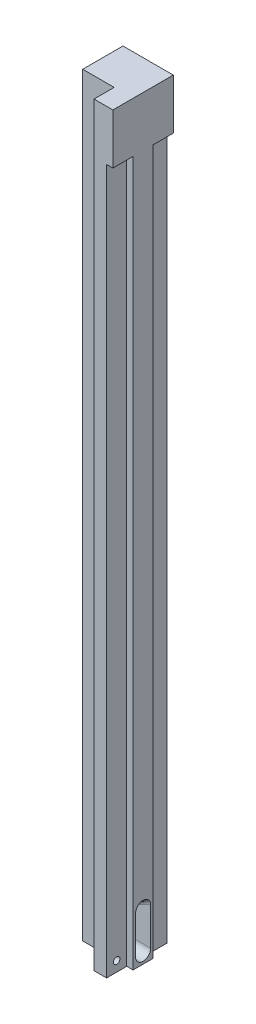
from build123d import *

# Parameters (mm, degrees)
SKETCH1_W           = 12.7
SKETCH1_H           = 190.5
BOSS_EXTRUDE1_DEPTH = 5.08
SKETCH5_W           = 3.175
SKETCH5_H           = 5.08
SKETCH5_W_2         = 11.1125
BOSS_EXTRUDE2_DEPTH = 190.5
SKETCH6_R           = 0.8255
CUT_EXTRUDE1_DEPTH  = 97.432752618
SKETCH7_W           = 1.5875
SKETCH7_H           = 5.08
BOSS_EXTRUDE3_DEPTH = 12.7


with BuildPart() as part:
    # Sketch1 → Boss-Extrude1 (new body)
    with BuildSketch(Plane.XY):
        Rectangle(SKETCH1_W, SKETCH1_H)
    extrude(amount=BOSS_EXTRUDE1_DEPTH)

    # Cut-Loft1: read off the stored shape, not the designer's step
    # Cut-Loft1: loft between two sections, ruled curve by curve
    cut_loft1_from = [
        Edge.make_bspline([(6.35, -92.71, 0.635), (6.35, -92.880627047, 0.635), (6.35, -93.190295538, 0.679451635), (6.35, -93.580426831, 0.829875615), (6.35, -93.904017113, 1.040042177), (6.35, -94.252532736, 1.378638842), (6.35, -94.539016945, 1.880682246), (6.35, -94.652993182, 2.54), (6.35, -94.539016945, 3.199317754), (6.35, -94.252532736, 3.701361158), (6.35, -93.904017113, 4.039957823), (6.35, -93.580426831, 4.250124385), (6.35, -93.190295538, 4.400548365), (6.35, -92.880627047, 4.445), (6.35, -92.100030361, 4.445), (6.35, -90.729103522, 4.445), (6.35, -87.9475, 4.445), (6.35, -85.165896478, 4.445), (6.35, -83.794969639, 4.445), (6.35, -83.185, 4.445)], [0, 0, 0, 0, 0.033003864, 0.066007727, 0.099011591, 0.132015455, 0.198023182, 0.264030909, 0.330038636, 0.396046364, 0.429050227, 0.462054091, 0.495057954, 0.528061818, 0.528061818, 0.646046364, 0.764030909, 0.882015455, 1, 1, 1, 1], 3),
        Edge.make_bspline([(6.35, -83.185, 4.445), (6.35, -82.922150477, 4.445), (6.35, -82.421175953, 4.339900308), (6.35, -81.805369524, 3.916723034), (6.35, -81.386700238, 3.309409446), (6.35, -81.226649881, 2.54), (6.35, -81.386700238, 1.770590554), (6.35, -81.805369524, 1.163276966), (6.35, -82.421175953, 0.740099692), (6.35, -82.922150477, 0.635), (6.35, -83.185, 0.635)], [0, 0, 0, 0, 0.125, 0.25, 0.375, 0.5, 0.625, 0.75, 0.875, 1, 1, 1, 1], 3),
        Edge.make_line((6.35, -92.71, 0.635), (6.35, -83.185, 0.635)),
    ]
    cut_loft1_to = [
        Edge.make_bspline([(-6.35, -92.71, 0.635), (-6.35, -92.81076887, 0.635), (-6.35, -93.018481978, 0.65100327), (-6.35, -93.339219021, 0.731183475), (-6.35, -93.659764721, 0.875704473), (-6.35, -94.064204291, 1.159019535), (-6.35, -94.484151999, 1.692137872), (-6.35, -94.680912476, 2.54), (-6.35, -94.484151999, 3.387862128), (-6.35, -94.064204291, 3.920980465), (-6.35, -93.659764721, 4.204295527), (-6.35, -93.339219021, 4.348816525), (-6.35, -93.018481978, 4.42899673), (-6.35, -92.81076887, 4.445), (-6.35, -92.349764316, 4.445), (-6.35, -91.828550912, 4.445), (-6.35, -91.1225, 4.445), (-6.35, -90.416449088, 4.445), (-6.35, -89.895235684, 4.445), (-6.35, -89.535, 4.445)], [0, 0, 0, 0, 0.033003864, 0.066007727, 0.099011591, 0.132015455, 0.198023182, 0.264030909, 0.330038636, 0.396046364, 0.429050227, 0.462054091, 0.495057954, 0.528061818, 0.528061818, 0.646046364, 0.764030909, 0.882015455, 1, 1, 1, 1], 3),
        Edge.make_bspline([(-6.35, -89.535, 4.445), (-6.35, -89.535, 4.28625), (-6.35, -89.535, 3.96875), (-6.35, -89.535, 3.4925), (-6.35, -89.535, 3.01625), (-6.35, -89.535, 2.54), (-6.35, -89.535, 2.06375), (-6.35, -89.535, 1.5875), (-6.35, -89.535, 1.11125), (-6.35, -89.535, 0.79375), (-6.35, -89.535, 0.635)], [0, 0, 0, 0, 0.125, 0.25, 0.375, 0.5, 0.625, 0.75, 0.875, 1, 1, 1, 1], 3),
        Edge.make_line((-6.35, -92.71, 0.635), (-6.35, -89.535, 0.635)),
    ]
    cut_loft1 = Solid(Shell([*[Face.make_surface_from_curves(cut_loft1_from[k], cut_loft1_to[k]) for k in range(3)], Face(Wire(cut_loft1_from)), Face(Wire(cut_loft1_to))]))
    add(cut_loft1, mode=Mode.SUBTRACT)

    # Sketch5 → Boss-Extrude2 (add)
    with BuildSketch(Plane.XZ.offset(95.25)):
        with Locations((3.175, 7.62)):
            Rectangle(SKETCH5_W, SKETCH5_H)
        with Locations((-0.79375, -2.54)):
            Rectangle(SKETCH5_W_2, SKETCH5_H)
    extrude(amount=-BOSS_EXTRUDE2_DEPTH)

    # Sketch6 → Cut-Extrude1 (cut, through all)
    with BuildSketch(Plane(origin=(4.7625, 0, 0), x_dir=(0, 0, -1), z_dir=(1, 0, 0))):
        with Locations((-7.62, -92.71)):
            Circle(SKETCH6_R)
    extrude(amount=-CUT_EXTRUDE1_DEPTH, mode=Mode.SUBTRACT)

    # Sketch7 → Boss-Extrude3 (add)
    with BuildSketch(Plane(origin=(0, 95.25, 0), x_dir=(1, 0, 0), z_dir=(0, 1, 0))):
        with Locations((5.55625, 2.54)):
            Rectangle(SKETCH7_W, SKETCH7_H)
        with Locations((5.55625, -7.62)):
            Rectangle(SKETCH7_W, SKETCH7_H)
    extrude(amount=-BOSS_EXTRUDE3_DEPTH)


solid = part.part
